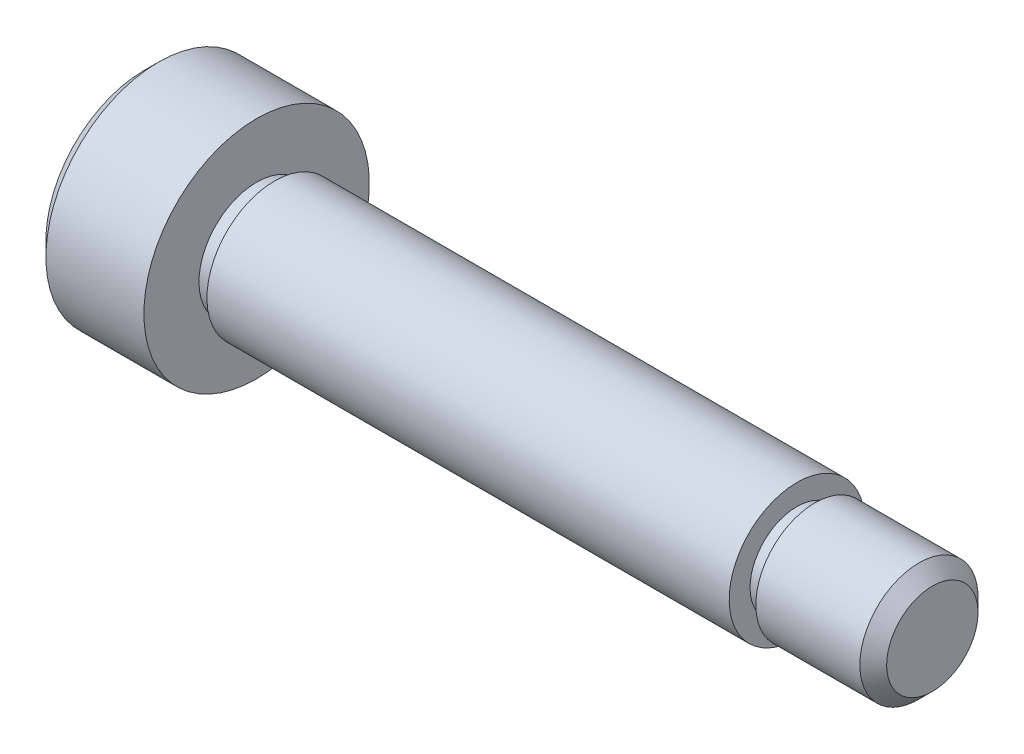
from build123d import *

# Parameters (mm, degrees)
CUT_EXTRUDE1_DEPTH = 1.1938


# Read off the part's stored shape, not the designer's step: #8-32 Machine Threads Stud1
with BuildPart() as part:
    # Sketch1 → Revolve1 (revolve)
    with BuildSketch(Plane.XY):
        Polygon((0, 0), (0, 3.4671), (0.508, 3.9751), (3.9624, 3.9751), (3.9624, 2.032), (4.5974, 2.032), (4.5974, 2.3876), (23.0124, 2.3876), (23.0124, 1.651), (23.6474, 1.651), (23.6474, 2.0828), (27.7876, 2.0828), (27.7876, 0), align=None)
    revolve(axis=Axis((27.7876, 0, 0), (-1, 0, 0)))

    # #8-32 Machine Threads Stud1 outline → #8-32 Machine Threads Stud1 (revolve, cut)
    with BuildSketch(Plane.YX):
        Polygon((2.0828, 27.7876), (1.61036, 27.7876), (2.0828, 27.31516), align=None)
    revolve(axis=Axis((0, 0, 0), (1, 0, 0)), mode=Mode.SUBTRACT)

    # Sketch3 → Cut-Extrude1 (cut)
    with BuildSketch(Plane.ZY):
        Polygon((1.363816806, 0), (0.681908403, 1.1811), (-0.681908403, 1.1811), (-1.363816806, 0), (-0.681908403, -1.1811), (0.681908403, -1.1811), align=None)
    extrude(amount=-CUT_EXTRUDE1_DEPTH, mode=Mode.SUBTRACT)


solid = part.part
